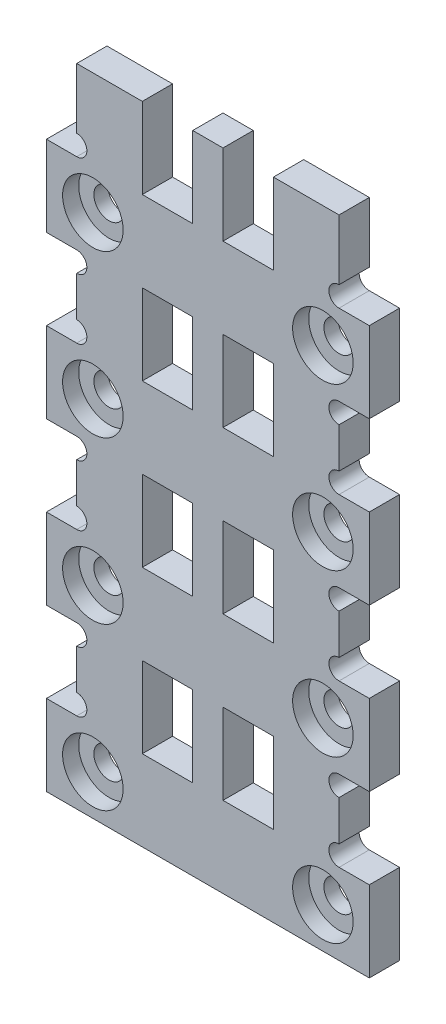
from build123d import *

# Parameters (mm, degrees)
EXTRUDE_1_DEPTH     = 3
SKETCH_2_W          = 5
SKETCH_2_H          = 8
CUT_EXTRUDE_1_DEPTH = 3
SKETCH_3_R          = 1.5
CUT_EXTRUDE_2_DEPTH = 3
SKETCH_4_R          = 3
CUT_EXTRUDE_3_DEPTH = 1.6
CUT_EXTRUDE_4_REACH = 68.038
SKETCH_5_R          = 1.005


with BuildPart() as part:
    # 草图1 → 凸台-拉伸1 (new body)
    with BuildSketch(Plane.XY):
        Polygon((16, 0), (-16, 0), (-16, 8), (-13, 8), (-13, 16), (-16, 16), (-16, 24), (-13, 24), (-13, 32), (-16, 32), (-16, 40), (-13, 40), (-13, 48), (-16, 48), (-16, 56), (-13, 56), (-13, 64), (13, 64), (13, 56), (16, 56), (16, 48), (13, 48), (13, 40), (16, 40), (16, 32), (13, 32), (13, 24), (16, 24), (16, 16), (13, 16), (13, 8), (16, 8), align=None)
    extrude(amount=EXTRUDE_1_DEPTH)

    # 草图2 → 切除-拉伸1 (cut)
    with BuildSketch(Plane.XY.offset(3)):
        with Locations((-4, 28)):
            Rectangle(SKETCH_2_W, SKETCH_2_H)
        with Locations((-4, 12)):
            Rectangle(SKETCH_2_W, SKETCH_2_H)
        with Locations((4, 28)):
            Rectangle(SKETCH_2_W, SKETCH_2_H)
        with Locations((-4, 44)):
            Rectangle(SKETCH_2_W, SKETCH_2_H)
        with Locations((4, 44)):
            Rectangle(SKETCH_2_W, SKETCH_2_H)
        with Locations((4, 12)):
            Rectangle(SKETCH_2_W, SKETCH_2_H)
        with Locations((4, 60)):
            Rectangle(SKETCH_2_W, SKETCH_2_H)
        with Locations((-4, 60)):
            Rectangle(SKETCH_2_W, SKETCH_2_H)
    extrude(amount=-CUT_EXTRUDE_1_DEPTH, mode=Mode.SUBTRACT)

    # 草图3 → 切除-拉伸2 (cut)
    with BuildSketch(Plane.XY.offset(3)):
        with Locations((-11.4, 4)):
            Circle(SKETCH_3_R)
        with Locations((11.4, 4)):
            Circle(SKETCH_3_R)
        with Locations((-11.4, 20)):
            Circle(SKETCH_3_R)
        with Locations((11.4, 20)):
            Circle(SKETCH_3_R)
        with Locations((-11.4, 36)):
            Circle(SKETCH_3_R)
        with Locations((11.4, 36)):
            Circle(SKETCH_3_R)
        with Locations((-11.4, 52)):
            Circle(SKETCH_3_R)
        with Locations((11.4, 52)):
            Circle(SKETCH_3_R)
    extrude(amount=-CUT_EXTRUDE_2_DEPTH, mode=Mode.SUBTRACT)

    # 草图4 → 切除-拉伸3 (cut)
    with BuildSketch(Plane.XY.offset(3)):
        with Locations((-11.4, 4)):
            Circle(SKETCH_4_R)
        with Locations((11.4, 4)):
            Circle(SKETCH_4_R)
        with Locations((-11.4, 20)):
            Circle(SKETCH_4_R)
        with Locations((11.4, 20)):
            Circle(SKETCH_4_R)
        with Locations((-11.4, 36)):
            Circle(SKETCH_4_R)
        with Locations((11.4, 36)):
            Circle(SKETCH_4_R)
        with Locations((-11.4, 52)):
            Circle(SKETCH_4_R)
        with Locations((11.4, 52)):
            Circle(SKETCH_4_R)
    extrude(amount=-CUT_EXTRUDE_3_DEPTH, mode=Mode.SUBTRACT)

    # 草图5 → 切除-拉伸4 (cut, up to next)
    with BuildSketch(Plane.XY.offset(3), mode=Mode.PRIVATE) as cut_extrude_4_sk1:
        with Locations((-13, 57.005)):
            Circle(SKETCH_5_R)
    cut_extrude_4_tool1 = extrude(cut_extrude_4_sk1.sketch, amount=-CUT_EXTRUDE_4_REACH, mode=Mode.PRIVATE) & part.part
    # 草图5 → 切除-拉伸4 (cut, up to next)
    with BuildSketch(Plane.XY.offset(3), mode=Mode.PRIVATE) as cut_extrude_4_sk2:
        with Locations((-13, 46.995)):
            Circle(SKETCH_5_R)
    cut_extrude_4_tool2 = extrude(cut_extrude_4_sk2.sketch, amount=-CUT_EXTRUDE_4_REACH, mode=Mode.PRIVATE) & part.part
    # 草图5 → 切除-拉伸4 (cut, up to next)
    with BuildSketch(Plane.XY.offset(3), mode=Mode.PRIVATE) as cut_extrude_4_sk3:
        with Locations((-13, 41.005)):
            Circle(SKETCH_5_R)
    cut_extrude_4_tool3 = extrude(cut_extrude_4_sk3.sketch, amount=-CUT_EXTRUDE_4_REACH, mode=Mode.PRIVATE) & part.part
    # 草图5 → 切除-拉伸4 (cut, up to next)
    with BuildSketch(Plane.XY.offset(3), mode=Mode.PRIVATE) as cut_extrude_4_sk4:
        with Locations((-13, 30.995)):
            Circle(SKETCH_5_R)
    cut_extrude_4_tool4 = extrude(cut_extrude_4_sk4.sketch, amount=-CUT_EXTRUDE_4_REACH, mode=Mode.PRIVATE) & part.part
    # 草图5 → 切除-拉伸4 (cut, up to next)
    with BuildSketch(Plane.XY.offset(3), mode=Mode.PRIVATE) as cut_extrude_4_sk5:
        with Locations((-13, 25.005)):
            Circle(SKETCH_5_R)
    cut_extrude_4_tool5 = extrude(cut_extrude_4_sk5.sketch, amount=-CUT_EXTRUDE_4_REACH, mode=Mode.PRIVATE) & part.part
    # 草图5 → 切除-拉伸4 (cut, up to next)
    with BuildSketch(Plane.XY.offset(3), mode=Mode.PRIVATE) as cut_extrude_4_sk6:
        with Locations((-13, 14.995)):
            Circle(SKETCH_5_R)
    cut_extrude_4_tool6 = extrude(cut_extrude_4_sk6.sketch, amount=-CUT_EXTRUDE_4_REACH, mode=Mode.PRIVATE) & part.part
    # 草图5 → 切除-拉伸4 (cut, up to next)
    with BuildSketch(Plane.XY.offset(3), mode=Mode.PRIVATE) as cut_extrude_4_sk7:
        with Locations((-13, 9.005)):
            Circle(SKETCH_5_R)
    cut_extrude_4_tool7 = extrude(cut_extrude_4_sk7.sketch, amount=-CUT_EXTRUDE_4_REACH, mode=Mode.PRIVATE) & part.part
    # 草图5 → 切除-拉伸4 (cut, up to next)
    with BuildSketch(Plane.XY.offset(3), mode=Mode.PRIVATE) as cut_extrude_4_sk8:
        with Locations((13, 9.005)):
            Circle(SKETCH_5_R)
    cut_extrude_4_tool8 = extrude(cut_extrude_4_sk8.sketch, amount=-CUT_EXTRUDE_4_REACH, mode=Mode.PRIVATE) & part.part
    # 草图5 → 切除-拉伸4 (cut, up to next)
    with BuildSketch(Plane.XY.offset(3), mode=Mode.PRIVATE) as cut_extrude_4_sk9:
        with Locations((13, 14.995)):
            Circle(SKETCH_5_R)
    cut_extrude_4_tool9 = extrude(cut_extrude_4_sk9.sketch, amount=-CUT_EXTRUDE_4_REACH, mode=Mode.PRIVATE) & part.part
    # 草图5 → 切除-拉伸4 (cut, up to next)
    with BuildSketch(Plane.XY.offset(3), mode=Mode.PRIVATE) as cut_extrude_4_sk10:
        with Locations((13, 25.005)):
            Circle(SKETCH_5_R)
    cut_extrude_4_tool10 = extrude(cut_extrude_4_sk10.sketch, amount=-CUT_EXTRUDE_4_REACH, mode=Mode.PRIVATE) & part.part
    # 草图5 → 切除-拉伸4 (cut, up to next)
    with BuildSketch(Plane.XY.offset(3), mode=Mode.PRIVATE) as cut_extrude_4_sk11:
        with Locations((13, 30.995)):
            Circle(SKETCH_5_R)
    cut_extrude_4_tool11 = extrude(cut_extrude_4_sk11.sketch, amount=-CUT_EXTRUDE_4_REACH, mode=Mode.PRIVATE) & part.part
    # 草图5 → 切除-拉伸4 (cut, up to next)
    with BuildSketch(Plane.XY.offset(3), mode=Mode.PRIVATE) as cut_extrude_4_sk12:
        with Locations((13, 41.005)):
            Circle(SKETCH_5_R)
    cut_extrude_4_tool12 = extrude(cut_extrude_4_sk12.sketch, amount=-CUT_EXTRUDE_4_REACH, mode=Mode.PRIVATE) & part.part
    # 草图5 → 切除-拉伸4 (cut, up to next)
    with BuildSketch(Plane.XY.offset(3), mode=Mode.PRIVATE) as cut_extrude_4_sk13:
        with Locations((13, 46.995)):
            Circle(SKETCH_5_R)
    cut_extrude_4_tool13 = extrude(cut_extrude_4_sk13.sketch, amount=-CUT_EXTRUDE_4_REACH, mode=Mode.PRIVATE) & part.part
    # 草图5 → 切除-拉伸4 (cut, up to next)
    with BuildSketch(Plane.XY.offset(3), mode=Mode.PRIVATE) as cut_extrude_4_sk14:
        with Locations((13, 57.005)):
            Circle(SKETCH_5_R)
    cut_extrude_4_tool14 = extrude(cut_extrude_4_sk14.sketch, amount=-CUT_EXTRUDE_4_REACH, mode=Mode.PRIVATE) & part.part
    add(cut_extrude_4_tool1.solids().sort_by_distance((-13, 57.005, 3))[0], mode=Mode.SUBTRACT)
    add(cut_extrude_4_tool2.solids().sort_by_distance((-13, 46.995, 3))[0], mode=Mode.SUBTRACT)
    add(cut_extrude_4_tool3.solids().sort_by_distance((-13, 41.005, 3))[0], mode=Mode.SUBTRACT)
    add(cut_extrude_4_tool4.solids().sort_by_distance((-13, 30.995, 3))[0], mode=Mode.SUBTRACT)
    add(cut_extrude_4_tool5.solids().sort_by_distance((-13, 25.005, 3))[0], mode=Mode.SUBTRACT)
    add(cut_extrude_4_tool6.solids().sort_by_distance((-13, 14.995, 3))[0], mode=Mode.SUBTRACT)
    add(cut_extrude_4_tool7.solids().sort_by_distance((-13, 9.005, 3))[0], mode=Mode.SUBTRACT)
    add(cut_extrude_4_tool8.solids().sort_by_distance((13, 9.005, 3))[0], mode=Mode.SUBTRACT)
    add(cut_extrude_4_tool9.solids().sort_by_distance((13, 14.995, 3))[0], mode=Mode.SUBTRACT)
    add(cut_extrude_4_tool10.solids().sort_by_distance((13, 25.005, 3))[0], mode=Mode.SUBTRACT)
    add(cut_extrude_4_tool11.solids().sort_by_distance((13, 30.995, 3))[0], mode=Mode.SUBTRACT)
    add(cut_extrude_4_tool12.solids().sort_by_distance((13, 41.005, 3))[0], mode=Mode.SUBTRACT)
    add(cut_extrude_4_tool13.solids().sort_by_distance((13, 46.995, 3))[0], mode=Mode.SUBTRACT)
    add(cut_extrude_4_tool14.solids().sort_by_distance((13, 57.005, 3))[0], mode=Mode.SUBTRACT)


solid = part.part
